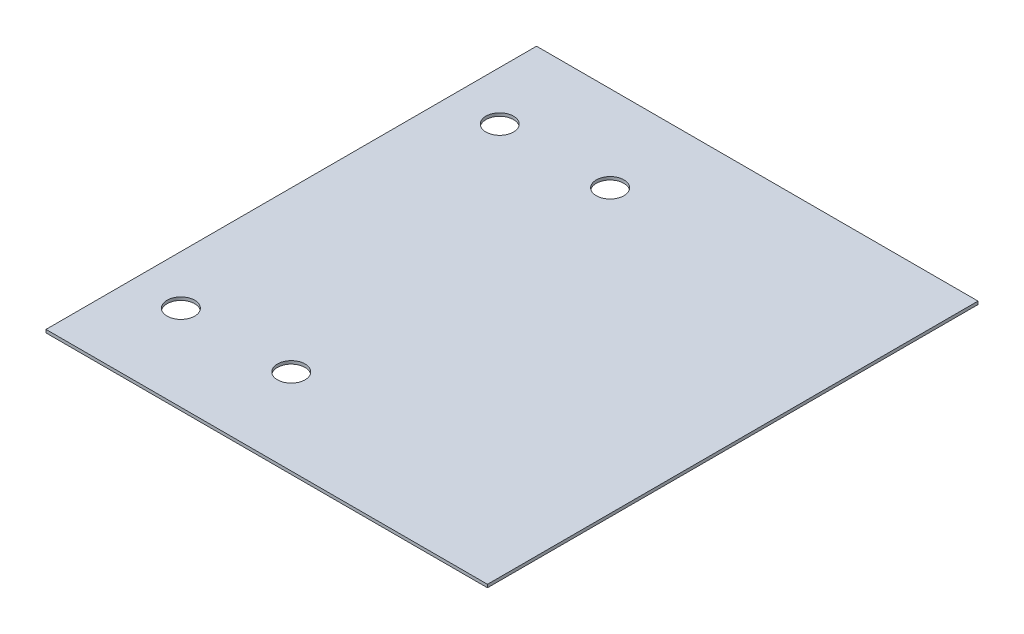
from build123d import *

# Parameters (mm, degrees)
SKETCH1_W           = 457.2
SKETCH1_H           = 508
BOSS_EXTRUDE1_DEPTH = 3.175
SKETCH2_R           = 14.2875
CUT_EXTRUDE1_DEPTH  = 3.175


with BuildPart() as part:
    # Sketch1 → Boss-Extrude1 (new body)
    with BuildSketch(Plane(origin=(0, 0, 0), x_dir=(1, 0, 0), z_dir=(0, 1, 0))):
        with Locations((228.6, 254)):
            Rectangle(SKETCH1_W, SKETCH1_H)
    extrude(amount=BOSS_EXTRUDE1_DEPTH)

    # Sketch2 → Cut-Extrude1 (cut)
    with BuildSketch(Plane(origin=(0, 3.175, 0), x_dir=(1, 0, 0), z_dir=(0, 1, 0))):
        with Locations((50.8, 419.1)):
            Circle(SKETCH2_R)
        with Locations((165.1, 419.1)):
            Circle(SKETCH2_R)
        with Locations((50.8, 88.9)):
            Circle(SKETCH2_R)
        with Locations((165.1, 88.9)):
            Circle(SKETCH2_R)
    extrude(amount=-CUT_EXTRUDE1_DEPTH, mode=Mode.SUBTRACT)


solid = part.part
